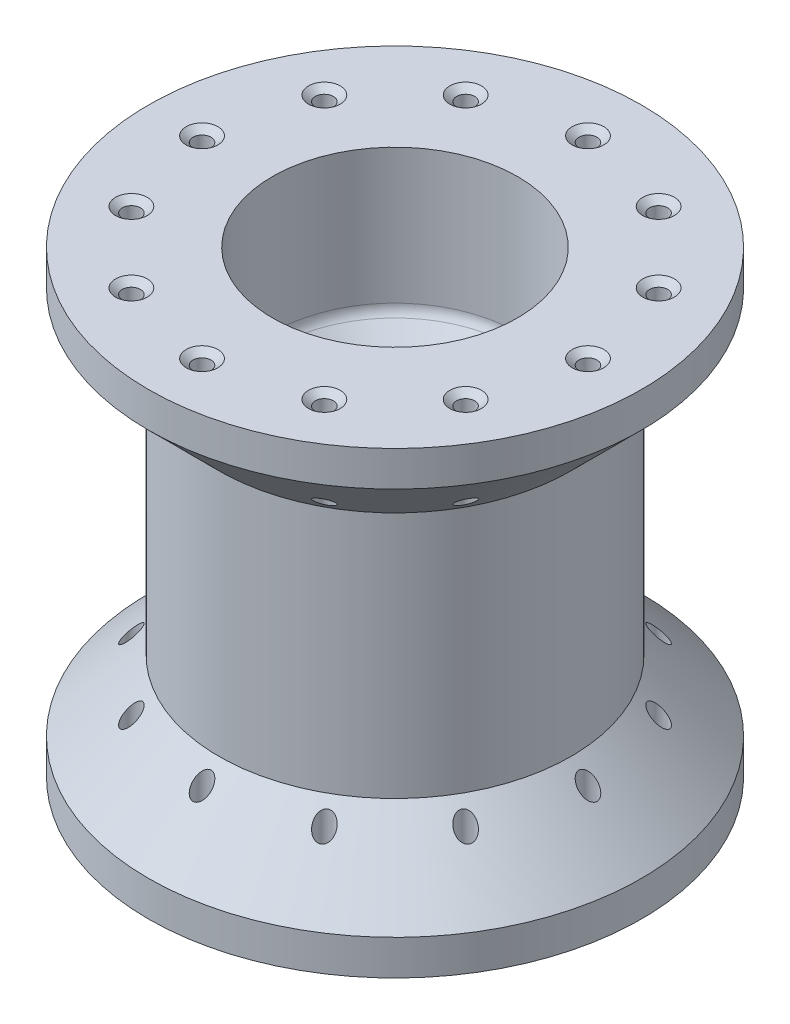
from build123d import *

# Parameters (mm, degrees)
CSK_FOR_4_FLAT_HEAD_MACHINE_SCREW_2_COUNT  = 2
CSK_FOR_4_FLAT_HEAD_MACHINE_SCREW_2_PITCH  = 34.799999996
CSK_FOR_4_FLAT_HEAD_MACHINE_SCREW_3_COUNT  = 2
CSK_FOR_4_FLAT_HEAD_MACHINE_SCREW_3_PITCH  = 34.799999996
CSK_FOR_4_FLAT_HEAD_MACHINE_SCREW_4_COUNT  = 2
CSK_FOR_4_FLAT_HEAD_MACHINE_SCREW_4_PITCH  = 34.799999996
CSK_FOR_4_FLAT_HEAD_MACHINE_SCREW_5_COUNT  = 2
CSK_FOR_4_FLAT_HEAD_MACHINE_SCREW_5_PITCH  = 34.799999996
CSK_FOR_4_FLAT_HEAD_MACHINE_SCREW_6_COUNT  = 2
CSK_FOR_4_FLAT_HEAD_MACHINE_SCREW_6_PITCH  = 34.799999996
CSK_FOR_4_FLAT_HEAD_MACHINE_SCREW_7_COUNT  = 2
CSK_FOR_4_FLAT_HEAD_MACHINE_SCREW_7_PITCH  = 34.799999996
CSK_FOR_4_FLAT_HEAD_MACHINE_SCREW_8_COUNT  = 2
CSK_FOR_4_FLAT_HEAD_MACHINE_SCREW_8_PITCH  = 34.799999996
CSK_FOR_4_FLAT_HEAD_MACHINE_SCREW_9_COUNT  = 2
CSK_FOR_4_FLAT_HEAD_MACHINE_SCREW_9_PITCH  = 34.799999996
CSK_FOR_4_FLAT_HEAD_MACHINE_SCREW_10_COUNT = 2
CSK_FOR_4_FLAT_HEAD_MACHINE_SCREW_10_PITCH = 34.799999996
CSK_FOR_4_FLAT_HEAD_MACHINE_SCREW_11_COUNT = 2
CSK_FOR_4_FLAT_HEAD_MACHINE_SCREW_11_PITCH = 34.799999996
CSK_FOR_4_FLAT_HEAD_MACHINE_SCREW_12_COUNT = 2
CSK_FOR_4_FLAT_HEAD_MACHINE_SCREW_12_PITCH = 34.799999996
CSK_FOR_4_FLAT_HEAD_MACHINE_SCREW_13_COUNT = 2
CSK_FOR_4_FLAT_HEAD_MACHINE_SCREW_13_PITCH = 34.799999996


with BuildPart() as part:
    # Sketch1 → Chamber (revolve)
    with BuildSketch(Plane(origin=(0, 0, 0), x_dir=(0, 0, -1), z_dir=(1, 0, 0))):
        Polygon((31.75, 82.699999954), (44.45, 82.699999954), (44.45, 76.349999954), (31.75, 63.649999954), (31.75, 19.05), (44.45, 6.35), (44.45, 0), (31.75, 0), (22.099999996, 0), (22.099999996, 6.35), (22.099999996, 76.349999954), (22.099999996, 82.699999954), align=None)
    revolve(axis=Axis((0, 0, 0), (0, 1, 0)))

    # Sketch4 → Turbulence Rings (revolve)
    with BuildSketch(Plane(origin=(0, 0, 0), x_dir=(0, 0, -1), z_dir=(1, 0, 0))):
        with BuildLine():
            Line((21.35605122, 56.556051178), (7.001974387, 42.201974345))
            ThreePointArc((7.001974387, 42.201974345), (6.726672993, 41.789956692), (6.629999999, 41.303948733))
            Line((6.629999999, 41.303948733), (6.629999999, 39.903210202))
            ThreePointArc((6.629999999, 39.903210202), (6.786798407, 39.6685448), (7.063605121, 39.723605079))
            Line((7.063605121, 39.723605079), (17.763948772, 50.42394873))
            ThreePointArc((17.763948772, 50.42394873), (20.532015914, 50.974551518), (22.099999996, 48.627897506))
            Line((22.099999996, 48.627897506), (22.099999996, 58.352102402))
            ThreePointArc((22.099999996, 58.352102402), (21.906654009, 57.380086484), (21.35605122, 56.556051178))
        make_face()
    revolve(axis=Axis((0, 0, 0), (0, 1, 0)))

    # Sketch15 → CSK for #4 Flat Head Machine Screw (100)2 (revolve, cut)
    with BuildSketch(Plane(origin=(0, 82.699999954, 0), x_dir=(0, 0, 1), z_dir=(1, 0, 0))):
        Polygon((0, 0), (0, 82.699999954), (2.26695, 82.699999954), (1.63195, 82.064999954), (1.63195, 1.028358553), (2.8575, 0), align=None)
    csk_for_4_flat_head_machine_screw_100 = revolve(axis=Axis((0, 89.049999954, 0), (0, -1, 0)), mode=Mode.SUBTRACT)

    # CSK for _4 Flat Head Machine Screw _ 2: CSK for #4 Flat Head Machine Screw (100)2 ×2
    with Locations(*[(-i * CSK_FOR_4_FLAT_HEAD_MACHINE_SCREW_2_PITCH, 0, 0) for i in range(1, CSK_FOR_4_FLAT_HEAD_MACHINE_SCREW_2_COUNT)]):
        add(csk_for_4_flat_head_machine_screw_100, mode=Mode.SUBTRACT)

    # CSK for _4 Flat Head Machine Screw _ 3: CSK for #4 Flat Head Machine Screw (100)2 ×2
    with Locations(*[Vector(-0.8660254037844387, 0, -0.4999999999999999) * (i * CSK_FOR_4_FLAT_HEAD_MACHINE_SCREW_3_PITCH) for i in range(1, CSK_FOR_4_FLAT_HEAD_MACHINE_SCREW_3_COUNT)]):
        add(csk_for_4_flat_head_machine_screw_100, mode=Mode.SUBTRACT)

    # CSK for _4 Flat Head Machine Screw _ 4: CSK for #4 Flat Head Machine Screw (100)2 ×2
    with Locations(*[Vector(-0.5000000000000001, 0, -0.8660254037844386) * (i * CSK_FOR_4_FLAT_HEAD_MACHINE_SCREW_4_PITCH) for i in range(1, CSK_FOR_4_FLAT_HEAD_MACHINE_SCREW_4_COUNT)]):
        add(csk_for_4_flat_head_machine_screw_100, mode=Mode.SUBTRACT)

    # CSK for _4 Flat Head Machine Screw _ 5: CSK for #4 Flat Head Machine Screw (100)2 ×2
    with Locations(*[(0, 0, -i * CSK_FOR_4_FLAT_HEAD_MACHINE_SCREW_5_PITCH) for i in range(1, CSK_FOR_4_FLAT_HEAD_MACHINE_SCREW_5_COUNT)]):
        add(csk_for_4_flat_head_machine_screw_100, mode=Mode.SUBTRACT)

    # CSK for _4 Flat Head Machine Screw _ 6: CSK for #4 Flat Head Machine Screw (100)2 ×2
    with Locations(*[Vector(0.4999999999999998, 0, -0.8660254037844388) * (i * CSK_FOR_4_FLAT_HEAD_MACHINE_SCREW_6_PITCH) for i in range(1, CSK_FOR_4_FLAT_HEAD_MACHINE_SCREW_6_COUNT)]):
        add(csk_for_4_flat_head_machine_screw_100, mode=Mode.SUBTRACT)

    # CSK for _4 Flat Head Machine Screw _ 7: CSK for #4 Flat Head Machine Screw (100)2 ×2
    with Locations(*[Vector(0.8660254037844384, 0, -0.5000000000000004) * (i * CSK_FOR_4_FLAT_HEAD_MACHINE_SCREW_7_PITCH) for i in range(1, CSK_FOR_4_FLAT_HEAD_MACHINE_SCREW_7_COUNT)]):
        add(csk_for_4_flat_head_machine_screw_100, mode=Mode.SUBTRACT)

    # CSK for _4 Flat Head Machine Screw _ 8: CSK for #4 Flat Head Machine Screw (100)2 ×2
    with Locations(*[(i * CSK_FOR_4_FLAT_HEAD_MACHINE_SCREW_8_PITCH, 0, 0) for i in range(1, CSK_FOR_4_FLAT_HEAD_MACHINE_SCREW_8_COUNT)]):
        add(csk_for_4_flat_head_machine_screw_100, mode=Mode.SUBTRACT)

    # CSK for _4 Flat Head Machine Screw _ 9: CSK for #4 Flat Head Machine Screw (100)2 ×2
    with Locations(*[Vector(0.8660254037844388, 0, 0.49999999999999967) * (i * CSK_FOR_4_FLAT_HEAD_MACHINE_SCREW_9_PITCH) for i in range(1, CSK_FOR_4_FLAT_HEAD_MACHINE_SCREW_9_COUNT)]):
        add(csk_for_4_flat_head_machine_screw_100, mode=Mode.SUBTRACT)

    # CSK for _4 Flat Head Machine Screw _ 10: CSK for #4 Flat Head Machine Screw (100)2 ×2
    with Locations(*[Vector(0.5000000000000004, 0, 0.8660254037844384) * (i * CSK_FOR_4_FLAT_HEAD_MACHINE_SCREW_10_PITCH) for i in range(1, CSK_FOR_4_FLAT_HEAD_MACHINE_SCREW_10_COUNT)]):
        add(csk_for_4_flat_head_machine_screw_100, mode=Mode.SUBTRACT)

    # CSK for _4 Flat Head Machine Screw _ 11: CSK for #4 Flat Head Machine Screw (100)2 ×2
    with Locations(*[(0, 0, i * CSK_FOR_4_FLAT_HEAD_MACHINE_SCREW_11_PITCH) for i in range(1, CSK_FOR_4_FLAT_HEAD_MACHINE_SCREW_11_COUNT)]):
        add(csk_for_4_flat_head_machine_screw_100, mode=Mode.SUBTRACT)

    # CSK for _4 Flat Head Machine Screw _ 12: CSK for #4 Flat Head Machine Screw (100)2 ×2
    with Locations(*[Vector(-0.4999999999999994, 0, 0.866025403784439) * (i * CSK_FOR_4_FLAT_HEAD_MACHINE_SCREW_12_PITCH) for i in range(1, CSK_FOR_4_FLAT_HEAD_MACHINE_SCREW_12_COUNT)]):
        add(csk_for_4_flat_head_machine_screw_100, mode=Mode.SUBTRACT)

    # CSK for _4 Flat Head Machine Screw _ 13: CSK for #4 Flat Head Machine Screw (100)2 ×2
    with Locations(*[Vector(-0.8660254037844387, 0, 0.4999999999999999) * (i * CSK_FOR_4_FLAT_HEAD_MACHINE_SCREW_13_PITCH) for i in range(1, CSK_FOR_4_FLAT_HEAD_MACHINE_SCREW_13_COUNT)]):
        add(csk_for_4_flat_head_machine_screw_100, mode=Mode.SUBTRACT)


solid = part.part
